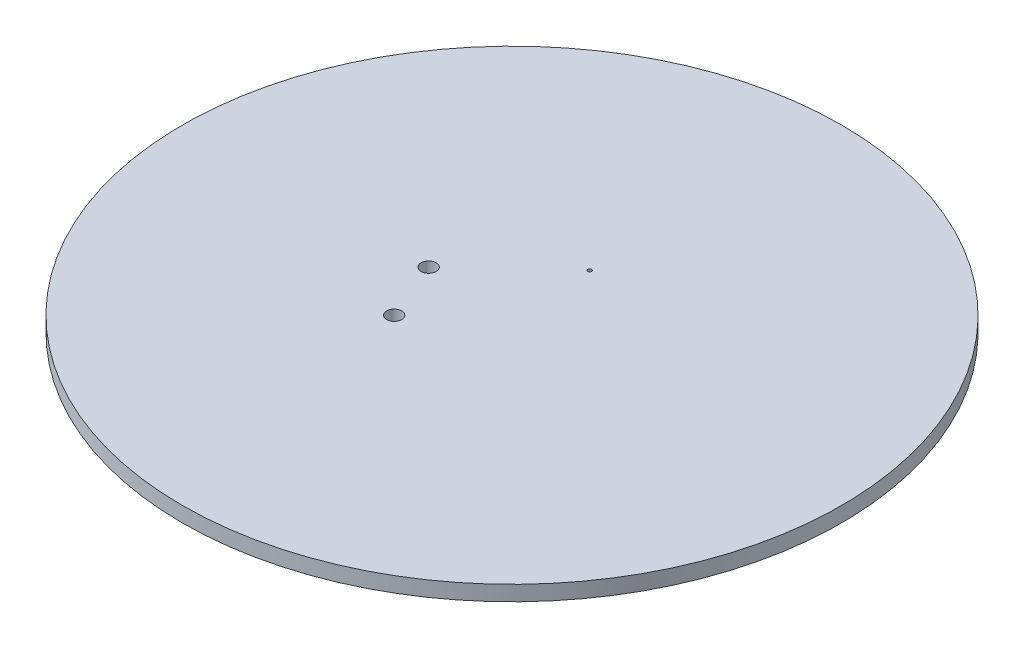
from build123d import *

# Parameters (mm, degrees)
SKETCH1_R               = 43.5
BOSS_EXTRUDE1_DEPTH     = 2
CUT_EXTRUDE1_DEPTH      = 62.550792034
CUT_EXTRUDE1_DEPTH_BACK = 62.550792034
SKETCH2_R               = 0.25
CUT_EXTRUDE2_DEPTH      = 62.550792034
CUT_EXTRUDE2_DEPTH_BACK = 62.550792034
SKETCH3_R               = 1


with BuildPart() as part:
    # Sketch1 → Boss-Extrude1 (new body)
    with BuildSketch(Plane(origin=(0, 0, 0), x_dir=(1, 0, 0), z_dir=(0, 1, 0))):
        Circle(SKETCH1_R)
    extrude(amount=BOSS_EXTRUDE1_DEPTH)

    # Sketch2 → Cut-Extrude1 (cut, two sides: drawn at the far end of the back side and taken through both)
    with BuildSketch(Plane(origin=(0, 2, 0), x_dir=(1, 0, 0), z_dir=(0, 1, 0)).offset(-CUT_EXTRUDE1_DEPTH_BACK)):
        with Locations((0, 10.25)):
            Circle(SKETCH2_R)
    extrude(amount=CUT_EXTRUDE1_DEPTH + CUT_EXTRUDE1_DEPTH_BACK, mode=Mode.SUBTRACT)

    # Sketch3 → Cut-Extrude2 (cut, two sides: drawn at the far end of the back side and taken through both)
    with BuildSketch(Plane(origin=(0, 2, 0), x_dir=(1, 0, 0), z_dir=(0, 1, 0)).offset(-CUT_EXTRUDE2_DEPTH_BACK)):
        with Locations((-11, 0)):
            Circle(SKETCH3_R)
        with Locations((-7.778174593, -7.778174593)):
            Circle(SKETCH3_R)
    extrude(amount=CUT_EXTRUDE2_DEPTH + CUT_EXTRUDE2_DEPTH_BACK, mode=Mode.SUBTRACT)


solid = part.part
